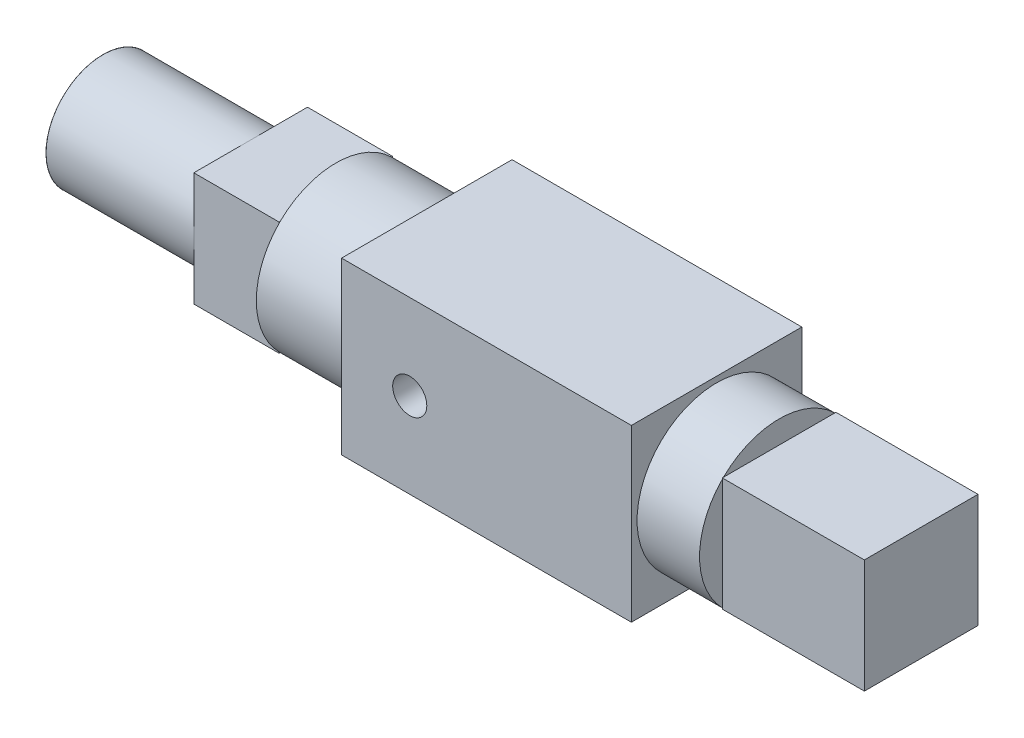
from build123d import *

# Parameters (mm, degrees)
SCHIZZO1_W                    = 15
SCHIZZO1_H                    = 15
ESTRUSIONE_ESTRUSIONE1_DEPTH  = 72
SCHIZZO2_W                    = 15
SCHIZZO2_H                    = 15
SCHIZZO2_R                    = 5
TAGLIO_ESTRUSIONE1_DEPTH      = 13
SCHIZZO3_W                    = 15
SCHIZZO3_H                    = 15
SCHIZZO3_W_2                  = 10
SCHIZZO3_H_2                  = 10
TAGLIO_ESTRUSIONE2_DEPTH      = 7.5
SCHIZZO4_W                    = 15
SCHIZZO4_H                    = 15
SCHIZZO4_R                    = 7
TAGLIO_ESTRUSIONE3_DEPTH      = 8
SCHIZZO6_W                    = 15
SCHIZZO6_H                    = 15
SCHIZZO6_W_2                  = 10
SCHIZZO6_H_2                  = 10
TAGLIO_ESTRUSIONE4_DEPTH      = 12.5
TAGLIO_ESTRUSIONE5_START      = -5.5
SCHIZZO8_W                    = 15
SCHIZZO8_H                    = 15
SCHIZZO8_R                    = 7
TAGLIO_ESTRUSIONE5_DEPTH      = 5.5
TAGLIO_ESTRUSIONE6_DEPTH      = 73.777056824
TAGLIO_ESTRUSIONE6_DEPTH_BACK = 73.777056824
SCHIZZO9_R                    = 1.5


with BuildPart() as part:
    # Schizzo1 → Estrusione-Estrusione1 (new body)
    with BuildSketch(Plane(origin=(0, 0, 0), x_dir=(0, 0, -1), z_dir=(1, 0, 0))):
        Rectangle(SCHIZZO1_W, SCHIZZO1_H)
    extrude(amount=ESTRUSIONE_ESTRUSIONE1_DEPTH)

    # Schizzo2 → Taglio-Estrusione1 (cut)
    with BuildSketch(Plane.ZY):
        Rectangle(SCHIZZO2_W, SCHIZZO2_H)
        Circle(SCHIZZO2_R, mode=Mode.SUBTRACT)
    extrude(amount=-TAGLIO_ESTRUSIONE1_DEPTH, mode=Mode.SUBTRACT)

    # Schizzo3 → Taglio-Estrusione2 (cut)
    with BuildSketch(Plane.ZY.offset(-13)):
        Rectangle(SCHIZZO3_W, SCHIZZO3_H)
        Rectangle(SCHIZZO3_W_2, SCHIZZO3_H_2, mode=Mode.SUBTRACT)
    extrude(amount=-TAGLIO_ESTRUSIONE2_DEPTH, mode=Mode.SUBTRACT)

    # Schizzo4 → Taglio-Estrusione3 (cut)
    with BuildSketch(Plane.ZY.offset(-20.5)):
        Rectangle(SCHIZZO4_W, SCHIZZO4_H)
        Circle(SCHIZZO4_R, mode=Mode.SUBTRACT)
    extrude(amount=-TAGLIO_ESTRUSIONE3_DEPTH, mode=Mode.SUBTRACT)

    # Schizzo5 → Rivoluzione1 (revolve)
    with BuildSketch(Plane.XY):
        with BuildLine():
            Line((0, 0), (0, 5.008991915))
            ThreePointArc((0, 5.008991915), (-0.969704108, 2.587469807), (-1.3, 0))
            Line((-1.3, 0), (0, 0))
        make_face()
    revolve(axis=Axis((0, 0, 0), (-1, 0, 0)))

    # Schizzo6 → Taglio-Estrusione4 (cut)
    with BuildSketch(Plane(origin=(72, 0, 0), x_dir=(0, 0, -1), z_dir=(1, 0, 0))):
        Rectangle(SCHIZZO6_W, SCHIZZO6_H)
        Rectangle(SCHIZZO6_W_2, SCHIZZO6_H_2, mode=Mode.SUBTRACT)
    extrude(amount=-TAGLIO_ESTRUSIONE4_DEPTH, mode=Mode.SUBTRACT)

    # Schizzo8 → Taglio-Estrusione5 (cut)
    with BuildSketch(Plane(origin=(59.5, 0, 0), x_dir=(0, 0, -1), z_dir=(1, 0, 0)).offset(TAGLIO_ESTRUSIONE5_START)):
        Rectangle(SCHIZZO8_W, SCHIZZO8_H)
        Circle(SCHIZZO8_R, mode=Mode.SUBTRACT)
    extrude(amount=TAGLIO_ESTRUSIONE5_DEPTH, mode=Mode.SUBTRACT)

    # Schizzo9 → Taglio-Estrusione6 (cut, two sides: drawn at the far end of the back side and taken through both)
    with BuildSketch(Plane.XY.offset(-TAGLIO_ESTRUSIONE6_DEPTH_BACK)):
        with Locations((34.5, 0)):
            Circle(SCHIZZO9_R)
    extrude(amount=TAGLIO_ESTRUSIONE6_DEPTH + TAGLIO_ESTRUSIONE6_DEPTH_BACK, mode=Mode.SUBTRACT)


solid = part.part
